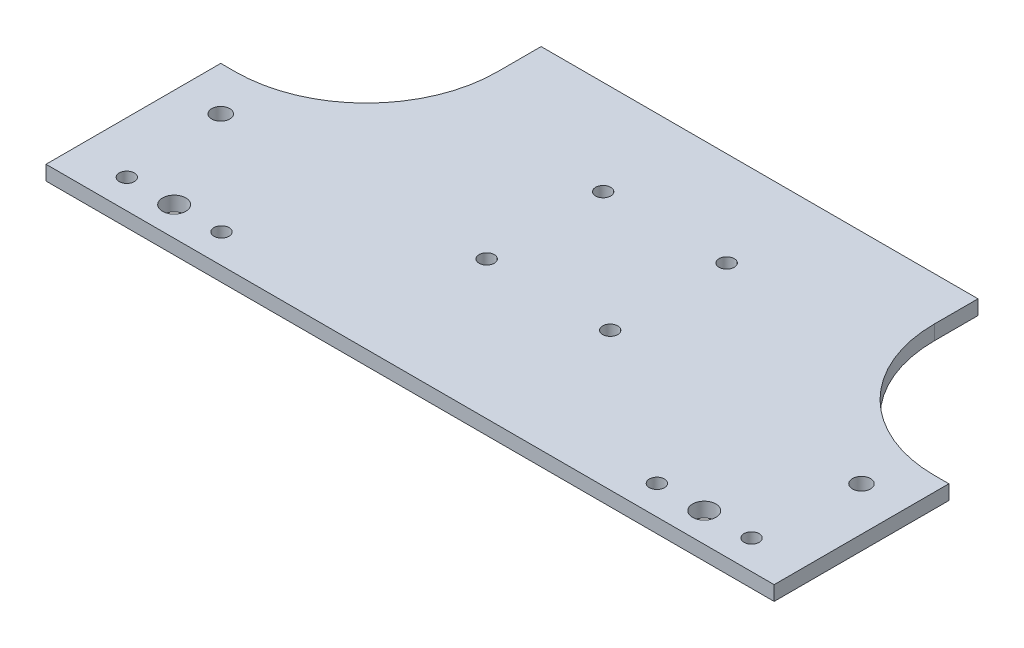
from build123d import *

# Parameters (mm, degrees)
SKETCH1_R           = 4
BOSS_EXTRUDE1_DEPTH = 5
SKETCH2_R           = 3.1
SKETCH2_R_2         = 2.6
CUT_EXTRUDE1_DEPTH  = 10


with BuildPart() as part:
    # Sketch1 → Boss-Extrude1 (new body)
    with BuildSketch(Plane(origin=(0, 0, 0), x_dir=(1, 0, 0), z_dir=(0, 1, 0))):
        with BuildLine():
            Line((-125, -45), (125, -45))
            Line((125, -45), (125, 15))
            Line((125, 15), (120, 15))
            ThreePointArc((120, 15), (88.180194847, 28.180194847), (75, 60))
            Line((75, 60), (75, 75))
            Line((75, 75), (0, 75))
            Line((0, 75), (-75, 75))
            Line((-75, 75), (-75, 60))
            ThreePointArc((-75, 60), (-88.180194847, 28.180194847), (-120, 15))
            Line((-120, 15), (-125, 15))
            Line((-125, 15), (-125, -45))
        make_face()
        with Locations((-91, -35)):
            Circle(SKETCH1_R, mode=Mode.SUBTRACT)
        with Locations((91, -35)):
            Circle(SKETCH1_R, mode=Mode.SUBTRACT)
    extrude(amount=BOSS_EXTRUDE1_DEPTH)

    # Sketch2 → Cut-Extrude1 (cut)
    with BuildSketch(Plane.XZ):
        with Locations((110, 0)):
            Circle(SKETCH2_R)
        with Locations((74.75, 35)):
            Circle(SKETCH2_R_2)
        with Locations((107.25, 35)):
            Circle(SKETCH2_R_2)
        with Locations((-110, 0)):
            Circle(SKETCH2_R)
        with Locations((-74.75, 35)):
            Circle(SKETCH2_R_2)
        with Locations((-107.25, 35)):
            Circle(SKETCH2_R_2)
        with Locations((-21.2, -2.5)):
            Circle(SKETCH2_R_2)
        with Locations((21.2, -2.5)):
            Circle(SKETCH2_R_2)
        with Locations((-21.2, -42.5)):
            Circle(SKETCH2_R_2)
        with Locations((21.2, -42.5)):
            Circle(SKETCH2_R_2)
    extrude(amount=-CUT_EXTRUDE1_DEPTH, mode=Mode.SUBTRACT)


solid = part.part
